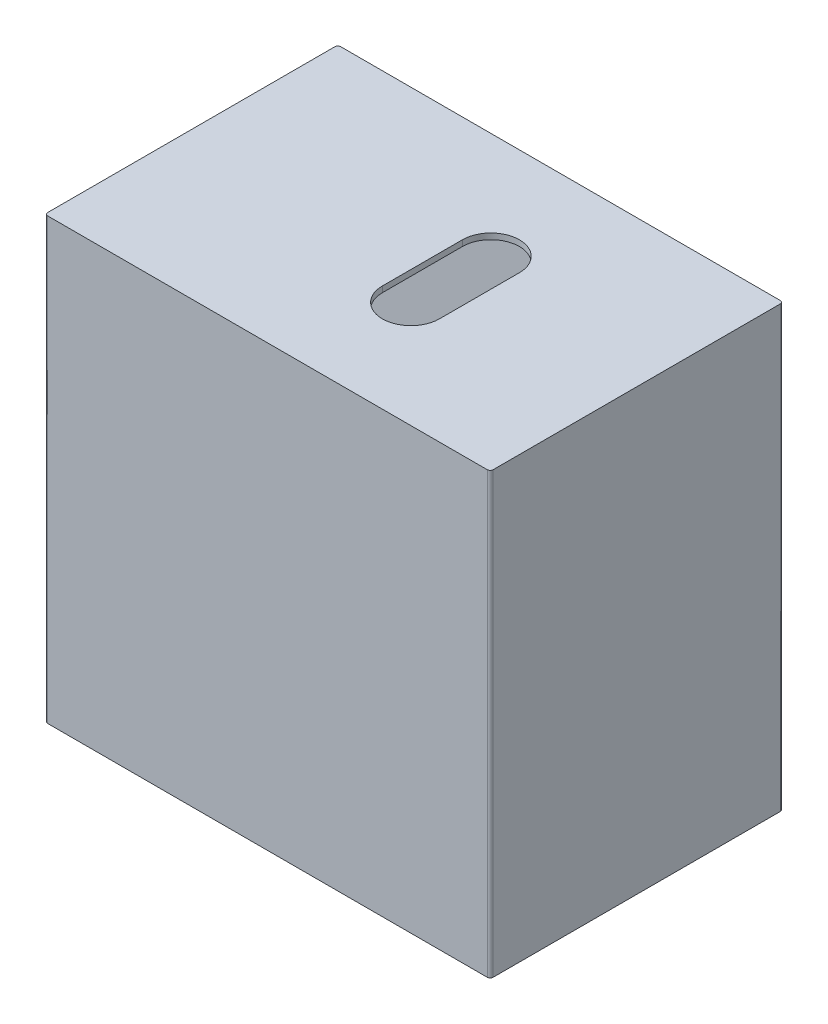
from build123d import *

# Parameters (mm, degrees)
BOSS_EXTRUDE7_DEPTH  = 150
SKETCH2_42_R         = 2
CUT_EXTRUDE8_DEPTH   = 3
SHELL4_DEPTH         = 148
SHELL4_START         = 5
SHELL4_2_DEPTH       = 143
SKETCH2_43_W         = 45.023033392
SKETCH2_43_H         = 36
BOSS_EXTRUDE8_DEPTH  = 36
SKETCH2_44_W         = 45.023033392
SKETCH2_44_H         = 36
CUT_EXTRUDE9_DEPTH   = 33
CUT_EXTRUDE11_DEPTH  = 33
FILLET4_R            = 1
BOSS_EXTRUDE11_DEPTH = 40
CUT_EXTRUDE16_DEPTH  = 40


# Read off the part's stored shape, not the designer's step: Shell4
with BuildPart() as part:
    # Sketch2 → Boss-Extrude7 (new body)
    with BuildSketch(Plane(origin=(0, 0, 0), x_dir=(1, 0, 0), z_dir=(0, 1, 0))):
        with BuildLine():
            Line((-76.129191463, 48.939688446), (-76.129191463, -49.060311554))
            ThreePointArc((-76.129191463, -49.060311554), (-75.836298244, -49.767418335), (-75.129191463, -50.060311554))
            Line((-75.129191463, -50.060311554), (74.870808537, -50.060311554))
            ThreePointArc((74.870808537, -50.060311554), (75.577915319, -49.767418335), (75.870808537, -49.060311554))
            Line((75.870808537, -49.060311554), (75.870808537, 48.939688446))
            ThreePointArc((75.870808537, 48.939688446), (75.577915319, 49.646795227), (74.870808537, 49.939688446))
            Line((74.870808537, 49.939688446), (-75.129191463, 49.939688446))
            ThreePointArc((-75.129191463, 49.939688446), (-75.836298244, 49.646795227), (-76.129191463, 48.939688446))
        make_face()
    extrude(amount=BOSS_EXTRUDE7_DEPTH)

    # Sketch2<42> → Cut-Extrude8 (cut)
    with BuildSketch(Plane(origin=(0, 0, 0), x_dir=(1, 0, 0), z_dir=(0, 1, 0))):
        with Locations(Location((-73.129191463, 46.939688446, 0), (0, 0, 270))):
            Circle(SKETCH2_42_R)
        with Locations(Location((72.870808537, 46.939688446, 0), (0, 0, 270))):
            Circle(SKETCH2_42_R)
        with Locations(Location((72.870808537, -47.060311554, 0), (0, 0, 270))):
            Circle(SKETCH2_42_R)
        with Locations(Location((-73.129191463, -47.060311554, 0), (0, 0, 270))):
            Circle(SKETCH2_42_R)
    extrude(amount=CUT_EXTRUDE8_DEPTH, mode=Mode.SUBTRACT)

    # Shell4 outline → Shell4 (cut)
    with BuildSketch(Plane(origin=(0, 0, 0), x_dir=(1, 0, 0), z_dir=(0, 1, 0))):
        with BuildLine():
            Line((-74.129191463, 43.0667051), (-74.129191463, -43.187328208))
            ThreePointArc((-74.129191463, -43.187328208), (-70.300764338, -44.231884429), (-69.256208116, -48.060311554))
            Line((-69.256208116, -48.060311554), (68.997825191, -48.060311554))
            ThreePointArc((68.997825191, -48.060311554), (70.042381413, -44.231884429), (73.870808537, -43.187328208))
            Line((73.870808537, -43.187328208), (73.870808537, 43.0667051))
            ThreePointArc((73.870808537, 43.0667051), (70.042381413, 44.111261321), (68.997825191, 47.939688446))
            Line((68.997825191, 47.939688446), (-69.256208116, 47.939688446))
            ThreePointArc((-69.256208116, 47.939688446), (-70.300764338, 44.111261321), (-74.129191463, 43.0667051))
        make_face()
    extrude(amount=SHELL4_DEPTH, mode=Mode.SUBTRACT)

    # Shell4 2 outline → Shell4 2 (cut)
    with BuildSketch(Plane(origin=(0, 0, 0), x_dir=(1, 0, 0), z_dir=(0, 1, 0)).offset(SHELL4_START)):
        with BuildLine():
            Line((-74.129191463, -43.187328208), (-74.129191463, -48.060311554))
            Line((-74.129191463, -48.060311554), (-69.256208116, -48.060311554))
            ThreePointArc((-69.256208116, -48.060311554), (-70.300764338, -44.231884429), (-74.129191463, -43.187328208))
        make_face()
        with BuildLine():
            Line((-74.129191463, 47.939688446), (-74.129191463, 43.0667051))
            ThreePointArc((-74.129191463, 43.0667051), (-70.300764338, 44.111261321), (-69.256208116, 47.939688446))
            Line((-69.256208116, 47.939688446), (-74.129191463, 47.939688446))
        make_face()
        with BuildLine():
            ThreePointArc((73.870808537, -43.187328208), (70.042381413, -44.231884429), (68.997825191, -48.060311554))
            Line((68.997825191, -48.060311554), (73.870808537, -48.060311554))
            Line((73.870808537, -48.060311554), (73.870808537, -43.187328208))
        make_face()
        with BuildLine():
            Line((73.870808537, 47.939688446), (68.997825191, 47.939688446))
            ThreePointArc((68.997825191, 47.939688446), (70.042381413, 44.111261321), (73.870808537, 43.0667051))
            Line((73.870808537, 43.0667051), (73.870808537, 47.939688446))
        make_face()
    extrude(amount=SHELL4_2_DEPTH, mode=Mode.SUBTRACT)

    # Sketch2<43> → Boss-Extrude8 (add)
    with BuildSketch(Plane(origin=(0, 0, 0), x_dir=(1, 0, 0), z_dir=(0, 1, 0))):
        Polygon((-76.129191463, -20.060311554), (-29.106158071, -20.060311554), (-29.106158071, 19.939688446), (-76.129191463, 19.939688446), (-76.129191463, 17.939688446), (-31.106158071, 17.939688446), (-31.106158071, -18.060311554), (-76.129191463, -18.060311554), align=None)
        with Locations((-53.617674767, -0.060311554)):
            Rectangle(SKETCH2_43_W, SKETCH2_43_H)
    extrude(amount=BOSS_EXTRUDE8_DEPTH)

    # Sketch2<44> → Cut-Extrude9 (cut)
    with BuildSketch(Plane(origin=(0, 0, 0), x_dir=(1, 0, 0), z_dir=(0, 1, 0))):
        with Locations((-53.617674767, -0.060311554)):
            Rectangle(SKETCH2_44_W, SKETCH2_44_H)
    extrude(amount=CUT_EXTRUDE9_DEPTH, mode=Mode.SUBTRACT)

    # Sketch7 → Cut-Extrude11 (cut)
    with BuildSketch(Plane.XZ.offset(-33)):
        with BuildLine():
            Line((-49.385393046, -8.706663468), (-49.385393046, 8.706663468))
            ThreePointArc((-49.385393046, 8.706663468), (-42.00713359, 16.084922924), (-34.628874134, 8.706663468))
            Line((-34.628874134, 8.706663468), (-34.628874134, -8.706663468))
            ThreePointArc((-34.628874134, -8.706663468), (-42.00713359, -16.084922924), (-49.385393046, -8.706663468))
        make_face()
    extrude(amount=-CUT_EXTRUDE11_DEPTH, mode=Mode.SUBTRACT)

    # Fillet4
    fillet4_edges = [part.edges().sort_by_distance(p)[0] for p in [
        (-76.129191463, 33, 0.060311554),
    ]]
    fillet(fillet4_edges, radius=FILLET4_R)

    # Sketch8 → Boss-Extrude11 (add)
    with BuildSketch(Plane(origin=(0, 150, 0), x_dir=(1, 0, 0), z_dir=(0, 1, 0))):
        with BuildLine():
            Line((2.680111603, -13.646632902), (2.680111603, 13.646632902))
            ThreePointArc((2.680111603, 13.646632902), (12.409959802, 23.376481102), (22.139808002, 13.646632902))
            Line((22.139808002, 13.646632902), (22.139808002, -13.646632902))
            ThreePointArc((22.139808002, -13.646632902), (12.409959802, -23.376481102), (2.680111603, -13.646632902))
        make_face()
    extrude(amount=-BOSS_EXTRUDE11_DEPTH)

    # Sketch8<7> → Cut-Extrude16 (cut)
    with BuildSketch(Plane(origin=(0, 150, 0), x_dir=(1, 0, 0), z_dir=(0, 1, 0))):
        with BuildLine():
            Line((2.680111603, -13.646632902), (2.680111603, 13.646632902))
            ThreePointArc((2.680111603, 13.646632902), (12.409959802, 23.376481102), (22.139808002, 13.646632902))
            Line((22.139808002, 13.646632902), (22.139808002, -13.646632902))
            ThreePointArc((22.139808002, -13.646632902), (12.409959802, -23.376481102), (2.680111603, -13.646632902))
        make_face()
    extrude(amount=-CUT_EXTRUDE16_DEPTH, mode=Mode.SUBTRACT)


solid = part.part
